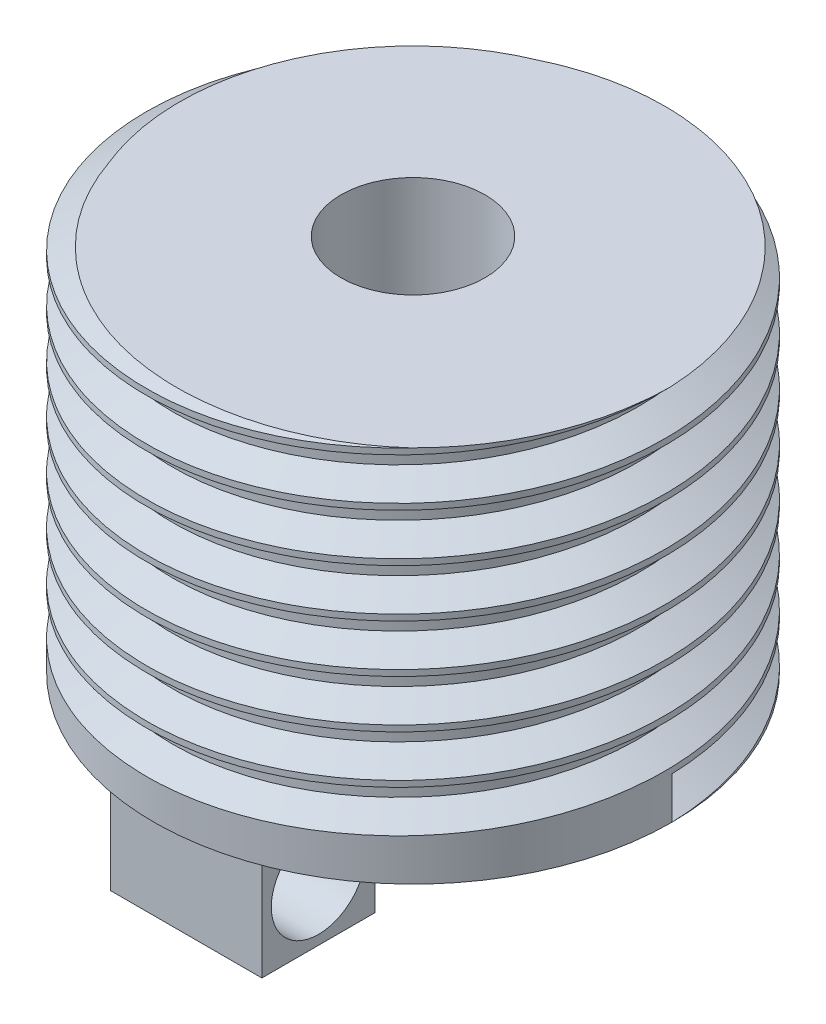
from build123d import *
from build123d.topology import SkipClean

# Parameters (mm, degrees)
SKETCH1_R                = 6.858
BOSS_EXTRUDE1_DEPTH      = 10
THREAD1_PITCH            = 1.27
SKETCH15_R               = 1.905
CUT_EXTRUDE1_DEPTH       = 10
BOSS_EXTRUDE2_DEPTH      = 2
BOSS_EXTRUDE2_DEPTH_BACK = 2
SKETCH16_W               = 3
SKETCH16_H               = 3
SKETCH17_R               = 1.25
CUT_EXTRUDE2_DEPTH       = 4


with BuildPart() as part:
    # Sketch1 → Boss-Extrude1 (new body)
    with BuildSketch(Plane(origin=(0, 0, 0), x_dir=(1, 0, 0), z_dir=(0, 1, 0))):
        with Locations(Location((0, 0, 0), (0, 0, 270))):
            Circle(SKETCH1_R)
    extrude(amount=BOSS_EXTRUDE1_DEPTH)

    # Thread1: the profile of Thread Profile4 profile screwed along a right-hand helix of 7.874016 turns, 8 arcs to a turn; built about Z, then put on its axis
    with SkipClean():  # the faces are left unmerged after this step: merging them gives an invalid solid
        thread1_z = Axis((0, 0, 0), (0, 0, 1))
        thread1_corners = [(6.8583, 0, -0.000173205), (6.8583, 0, 1.111423202), (6.170592339, 0, 0.714374998), (6.170592339, 0, 0.396874998)]
        with BuildLine(mode=Mode.PRIVATE) as thread1_profile:
            Line(thread1_corners[0], thread1_corners[1])
            Line(thread1_corners[1], thread1_corners[2])
            Line(thread1_corners[2], thread1_corners[3])
            Line(thread1_corners[3], thread1_corners[0])
        thread1_cap = Face(thread1_profile.wire())
        thread1_turn_angles = [0, 22.5, 45, 67.5, 90, 112.5, 135, 157.5, 180, 202.5, 225, 247.5, 270, 292.5, 315, 337.5, 360]
        thread1_turn_weights = [1, 0.9238795325112867, 1, 0.9238795325112867, 1, 0.9238795325112867, 1, 0.9238795325112867, 1, 0.9238795325112867, 1, 0.9238795325112867, 1, 0.9238795325112867, 1, 0.9238795325112867, 1]
        thread1_turn_rails = [Edge.make_bspline([Vector(p[0], p[1], 0).rotate(thread1_z, thread1_turn_angles[k]) / thread1_turn_weights[k] + Vector(0, 0, p[2] + THREAD1_PITCH * thread1_turn_angles[k] / 360) for k in range(17)], [0, 0, 0, 1, 1, 2, 2, 3, 3, 4, 4, 5, 5, 6, 6, 7, 7, 8, 8, 8], 2, thread1_turn_weights) for p in thread1_corners]
        thread1_turn_sides = [Face.make_surface_from_curves(thread1_turn_rails[p[0]], thread1_turn_rails[p[1]]) for p in [(0, 1), (1, 2), (2, 3), (3, 0)]]
        thread1_last_angles = [2520, 2542.5, 2565, 2587.5, 2610, 2632.5, 2655, 2677.5, 2700, 2722.5, 2745, 2767.5, 2790, 2812.322834646, 2834.645669291]
        thread1_last_weights = [1, 0.9238795325112867, 1, 0.9238795325112867, 1, 0.9238795325112867, 1, 0.9238795325112867, 1, 0.9238795325112867, 1, 0.9238795325112867, 1, 0.9250584165493104, 1]
        thread1_last_rails = [Edge.make_bspline([Vector(p[0], p[1], 0).rotate(thread1_z, thread1_last_angles[k]) / thread1_last_weights[k] + Vector(0, 0, p[2] + THREAD1_PITCH * thread1_last_angles[k] / 360) for k in range(15)], [0, 0, 0, 1, 1, 2, 2, 3, 3, 4, 4, 5, 5, 6, 6, 7, 7, 7], 2, thread1_last_weights) for p in thread1_corners]
        thread1_last_sides = [Face.make_surface_from_curves(thread1_last_rails[p[0]], thread1_last_rails[p[1]]) for p in [(0, 1), (1, 2), (2, 3), (3, 0)]]
        thread1 = Plane(origin=(0, 0, 0), x_dir=(1, 0, 0), z_dir=(0, 1, 0)) * Solid(Shell([*[p.moved(Location((0, 0, THREAD1_PITCH * i))) for i in range(7) for p in thread1_turn_sides], *thread1_last_sides, thread1_cap, thread1_cap.rotate(thread1_z, 2834.645669291).moved(Location((0, 0, THREAD1_PITCH * 2834.645669291 / 360)))]))
        add(thread1, mode=Mode.SUBTRACT)

    # Sketch15 → Cut-Extrude1 (cut)
    with SkipClean():  # the faces are left unmerged after this step: merging them gives an invalid solid
        with BuildSketch(Plane.XZ):
            with Locations(Location((0, 0, 0), (0, 0, 270))):
                Circle(SKETCH15_R)
        extrude(amount=-CUT_EXTRUDE1_DEPTH, mode=Mode.SUBTRACT)

    # Sketch16 → Boss-Extrude2 (add, two sides: drawn at the far end of the back side and taken through both)
    with SkipClean():  # the faces are left unmerged after this step: merging them gives an invalid solid
        with BuildSketch(Plane(origin=(0, 0, 0), x_dir=(0, 0, -1), z_dir=(1, 0, 0)).offset(-BOSS_EXTRUDE2_DEPTH_BACK)):
            with Locations((4.5, -1.5)):
                Rectangle(SKETCH16_W, SKETCH16_H)
            with Locations((-4.5, -1.5)):
                Rectangle(SKETCH16_W, SKETCH16_H)
        extrude(amount=BOSS_EXTRUDE2_DEPTH + BOSS_EXTRUDE2_DEPTH_BACK)

    # Sketch17 → Cut-Extrude2 (cut)
    with SkipClean():  # the faces are left unmerged after this step: merging them gives an invalid solid
        with BuildSketch(Plane.ZY.offset(2)):
            with Locations((4.5, -1.5)):
                Circle(SKETCH17_R)
            with Locations(Location((-4.5, -1.5, 0), (0, 0, 180))):
                Circle(SKETCH17_R)
        extrude(amount=-CUT_EXTRUDE2_DEPTH, mode=Mode.SUBTRACT)


solid = part.part
